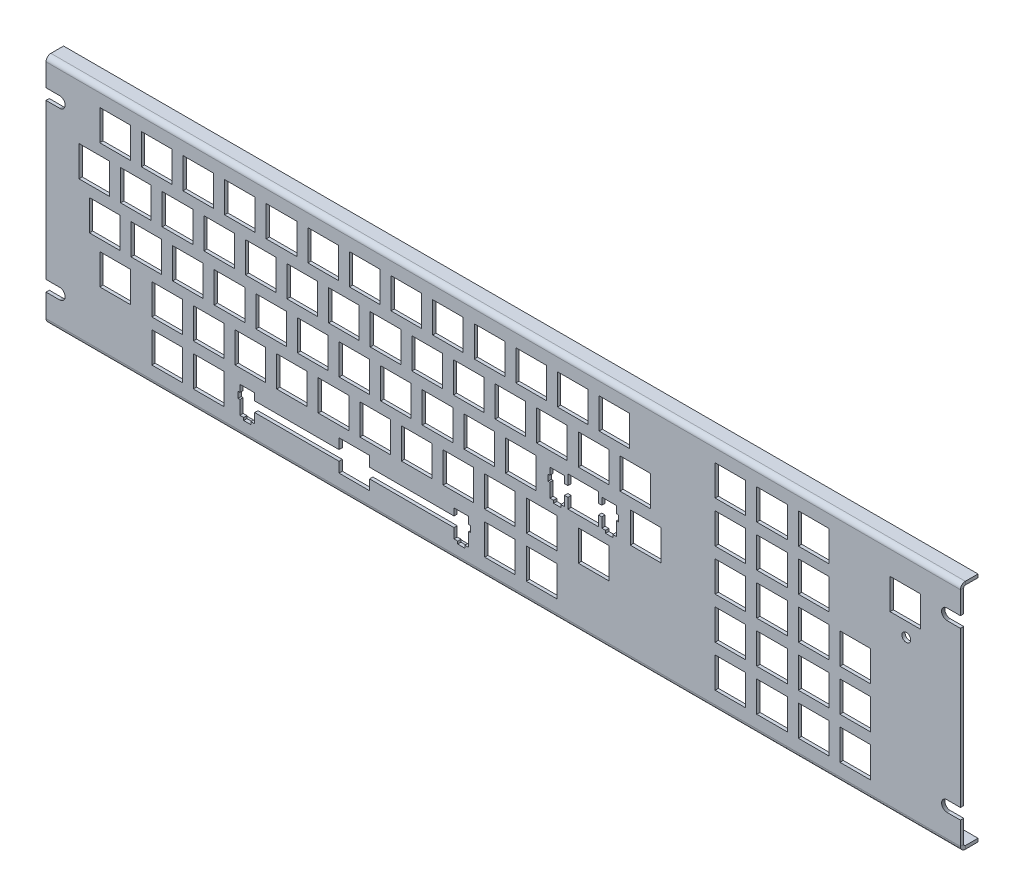
from build123d import *

# Parameters (mm, degrees)
MODEL_R                = 2
MODEL_W                = 14
MODEL_H                = 14
BASE_FLANGE1_DEPTH     = 1.5
SKETCHED_START         = -13.87500635
SKETCHED_BEND1_DEPTH   = 418.67500635
SKETCHED_BEND1_2_DEPTH = 418.67500635
CUT_EXTRUDE1_DEPTH     = 422.76606267
SKETCH12_R             = 2
BOSS_EXTRUDE4_DEPTH    = 1.5


# Read off the part's stored shape, not the designer's step: Sketched Bend1
# Sheet-metal steps are written as plain solids
with BuildPart() as part:
    # Model → Base-Flange1 (new body)
    with BuildSketch(Plane.XY):
        Polygon((404.8, -10), (404.8, -24.5), (398.662814326, -24.5), (398.591424199, -24.501019518), (398.520092298, -24.50407724), (398.448876804, -24.509170673), (398.377835801, -24.516295662), (398.30702723, -24.525446395), (398.236508844, -24.53661541), (398.166338159, -24.549793597), (398.096572407, -24.564970208), (398.02726849, -24.582132863), (397.958482934, -24.601267566), (397.89027184, -24.622358709), (397.822690843, -24.645389091), (397.755795062, -24.670339927), (397.68963906, -24.697190867), (397.624276793, -24.725920012), (397.559761573, -24.756503928), (397.496146018, -24.788917673), (397.433482014, -24.823134807), (397.371820672, -24.859127424), (397.311212282, -24.896866168), (397.251706278, -24.936320258), (397.193351195, -24.977457514), (397.136194627, -25.020244385), (397.080283191, -25.064645973), (397.025662491, -25.110626064), (396.972377075, -25.158147155), (396.920470404, -25.207170488), (396.869984814, -25.257656078), (396.820961481, -25.309562749), (396.77344039, -25.362848165), (396.727460299, -25.417468865), (396.683058711, -25.473380301), (396.64027184, -25.530536869), (396.599134583, -25.588891953), (396.559680494, -25.648397956), (396.52194175, -25.709006346), (396.485949133, -25.770667688), (396.451731998, -25.833331692), (396.419318254, -25.896947247), (396.388734337, -25.961462467), (396.360005193, -26.026824734), (396.333154253, -26.092980737), (396.308203417, -26.159876517), (396.285173035, -26.227457514), (396.264081892, -26.295668608), (396.244947189, -26.364454165), (396.227784533, -26.433758081), (396.212607923, -26.503523833), (396.199429736, -26.573694518), (396.188260721, -26.644212904), (396.179109987, -26.715021475), (396.171984998, -26.786062479), (396.166891566, -26.857277973), (396.163833844, -26.928609873), (396.162814326, -27), (396.163833844, -27.071390127), (396.166891566, -27.142722027), (396.171984998, -27.213937521), (396.179109987, -27.284978525), (396.188260721, -27.355787096), (396.199429736, -27.426305482), (396.212607923, -27.496476167), (396.227784533, -27.566241919), (396.244947189, -27.635545835), (396.264081892, -27.704331392), (396.285173035, -27.772542486), (396.308203417, -27.840123483), (396.333154253, -27.907019263), (396.360005193, -27.973175266), (396.388734337, -28.038537533), (396.419318254, -28.103052753), (396.451731998, -28.166668308), (396.485949133, -28.229332312), (396.52194175, -28.290993654), (396.559680494, -28.351602044), (396.599134583, -28.411108047), (396.64027184, -28.469463131), (396.683058711, -28.526619699), (396.727460299, -28.582531135), (396.77344039, -28.637151835), (396.820961481, -28.690437251), (396.869984814, -28.742343922), (396.920470404, -28.792829512), (396.972377075, -28.841852845), (397.025662491, -28.889373936), (397.080283191, -28.935354027), (397.136194627, -28.979755615), (397.193351195, -29.022542486), (397.251706278, -29.063679742), (397.311212282, -29.103133832), (397.371820672, -29.140872576), (397.433482014, -29.176865193), (397.496146018, -29.211082327), (397.559761573, -29.243496072), (397.624276793, -29.274079988), (397.68963906, -29.302809133), (397.755795062, -29.329660073), (397.822690843, -29.354610909), (397.89027184, -29.377641291), (397.958482934, -29.398732434), (398.02726849, -29.417867137), (398.096572407, -29.435029792), (398.166338159, -29.450206403), (398.236508844, -29.46338459), (398.30702723, -29.474553605), (398.377835801, -29.483704338), (398.448876804, -29.490829327), (398.520092298, -29.49592276), (398.591424199, -29.498980482), (398.662814326, -29.5), (404.8, -29.5), (404.8, -100.55), (398.662814326, -100.55), (398.591424195, -100.551019513), (398.520092291, -100.55407723), (398.448876794, -100.559170658), (398.377835786, -100.566295642), (398.307027211, -100.575446371), (398.236508821, -100.586615382), (398.166338132, -100.599793565), (398.096572376, -100.614970171), (398.027268454, -100.632132823), (397.958482893, -100.651267523), (397.890271795, -100.672358663), (397.822690793, -100.695389042), (397.755795008, -100.720339875), (397.689639001, -100.747190813), (397.62427673, -100.775919955), (397.559761504, -100.80650387), (397.496145945, -100.838917612), (397.433481936, -100.873134745), (397.371820589, -100.909127361), (397.311212195, -100.946866103), (397.251706187, -100.986320192), (397.193351099, -101.027457448), (397.136194526, -101.070244319), (397.080283086, -101.114645906), (397.025662381, -101.160625997), (396.97237696, -101.208147088), (396.920470285, -101.257170422), (396.869984691, -101.307656012), (396.820961354, -101.359562684), (396.773440258, -101.412848101), (396.727460163, -101.467468802), (396.683058571, -101.523380239), (396.640271696, -101.580536808), (396.599134436, -101.638891894), (396.559680343, -101.698397899), (396.521941596, -101.75900629), (396.485948976, -101.820667635), (396.451731838, -101.883331641), (396.419318091, -101.946947198), (396.388734171, -102.011462421), (396.360005024, -102.07682469), (396.333154081, -102.142980695), (396.308203243, -102.209876478), (396.285172859, -102.277457478), (396.264081714, -102.345668575), (396.244947009, -102.414454135), (396.227784352, -102.483758055), (396.21260774, -102.55352381), (396.199429552, -102.623694498), (396.188260536, -102.694212887), (396.179109801, -102.765021462), (396.171984812, -102.836062468), (396.166891379, -102.907277966), (396.163833656, -102.978609869), (396.162814138, -103.05), (396.163833656, -103.12139013), (396.166891379, -103.192722034), (396.171984812, -103.263937531), (396.179109801, -103.334978538), (396.188260536, -103.405787112), (396.199429552, -103.476305501), (396.21260774, -103.54647619), (396.227784352, -103.616241945), (396.244947009, -103.685545865), (396.264081714, -103.754331425), (396.285172859, -103.822542521), (396.308203243, -103.890123521), (396.333154081, -103.957019304), (396.360005024, -104.023175309), (396.388734171, -104.088537579), (396.41931809, -104.153052802), (396.451731838, -104.216668359), (396.485948975, -104.279332365), (396.521941596, -104.340993709), (396.559680343, -104.401602101), (396.599134436, -104.461108106), (396.640271696, -104.519463191), (396.683058571, -104.576619761), (396.727460163, -104.632531198), (396.773440258, -104.687151899), (396.820961353, -104.740437316), (396.86998469, -104.792343987), (396.920470285, -104.842829578), (396.97237696, -104.891852911), (397.02566238, -104.939374003), (397.080283085, -104.985354093), (397.136194525, -105.029755681), (397.193351098, -105.072542552), (397.251706186, -105.113679808), (397.311212195, -105.153133896), (397.371820589, -105.190872639), (397.433481936, -105.226865255), (397.496145944, -105.261082388), (397.559761504, -105.29349613), (397.624276729, -105.324080045), (397.689639001, -105.352809187), (397.755795008, -105.379660125), (397.822690793, -105.404610958), (397.890271794, -105.427641337), (397.958482893, -105.448732477), (398.027268454, -105.467867176), (398.096572375, -105.485029829), (398.166338131, -105.500206435), (398.236508821, -105.513384618), (398.307027211, -105.524553629), (398.377835786, -105.533704358), (398.448876793, -105.540829342), (398.520092291, -105.54592277), (398.591424195, -105.548980487), (398.662814325, -105.55), (404.8, -105.55), (404.8, -117), (404.8, -123.2001524), (-13.87500635, -123.2001524), (-13.87500635, -117), (-13.87500635, -105.5), (-7.629032258, -105.5), (-7.557642128, -105.498980487), (-7.486310224, -105.49592277), (-7.415094726, -105.490829342), (-7.344053719, -105.483704358), (-7.273245144, -105.474553629), (-7.202726754, -105.463384618), (-7.132556064, -105.450206435), (-7.062790308, -105.435029829), (-6.993486387, -105.417867177), (-6.924700826, -105.398732477), (-6.856489727, -105.377641337), (-6.788908726, -105.354610958), (-6.722012941, -105.329660125), (-6.655856934, -105.302809187), (-6.590494662, -105.274080045), (-6.525979437, -105.24349613), (-6.462363877, -105.211082388), (-6.399699869, -105.176865255), (-6.338038522, -105.140872639), (-6.277430127, -105.103133897), (-6.217924119, -105.063679808), (-6.159569031, -105.022542552), (-6.102412458, -104.979755681), (-6.046501018, -104.935354094), (-5.991880313, -104.889374003), (-5.938594893, -104.841852912), (-5.886688218, -104.792829578), (-5.836202623, -104.742343988), (-5.787179286, -104.690437316), (-5.739658191, -104.637151899), (-5.693678096, -104.582531198), (-5.649276504, -104.526619761), (-5.606489629, -104.469463192), (-5.565352369, -104.411108106), (-5.525898275, -104.351602101), (-5.488159529, -104.29099371), (-5.452166908, -104.229332365), (-5.41794977, -104.166668359), (-5.385536023, -104.103052802), (-5.354952104, -104.038537579), (-5.326222956, -103.97317531), (-5.299372014, -103.907019305), (-5.274421175, -103.840123522), (-5.251390792, -103.772542522), (-5.230299646, -103.704331425), (-5.211164942, -103.635545865), (-5.194002284, -103.566241945), (-5.178825673, -103.49647619), (-5.165647485, -103.426305502), (-5.154478468, -103.355787113), (-5.145327734, -103.284978538), (-5.138202744, -103.213937532), (-5.133109311, -103.142722034), (-5.130051589, -103.071390131), (-5.129032071, -103), (-5.130051589, -102.92860987), (-5.133109311, -102.857277966), (-5.138202744, -102.786062469), (-5.145327734, -102.715021462), (-5.154478468, -102.644212888), (-5.165647484, -102.573694499), (-5.178825673, -102.50352381), (-5.194002284, -102.433758055), (-5.211164942, -102.364454135), (-5.230299646, -102.295668575), (-5.251390791, -102.227457479), (-5.274421175, -102.159876479), (-5.299372014, -102.092980696), (-5.326222956, -102.026824691), (-5.354952103, -101.961462421), (-5.385536023, -101.896947198), (-5.41794977, -101.833331641), (-5.452166908, -101.770667635), (-5.488159528, -101.709006291), (-5.525898275, -101.648397899), (-5.565352368, -101.588891894), (-5.606489629, -101.530536809), (-5.649276503, -101.473380239), (-5.693678096, -101.417468802), (-5.73965819, -101.362848101), (-5.787179286, -101.309562684), (-5.836202623, -101.257656013), (-5.886688217, -101.207170422), (-5.938594892, -101.158147089), (-5.991880313, -101.110625997), (-6.046501018, -101.064645907), (-6.102412458, -101.020244319), (-6.159569031, -100.977457448), (-6.217924119, -100.936320192), (-6.277430127, -100.896866104), (-6.338038521, -100.859127361), (-6.399699868, -100.823134745), (-6.462363877, -100.788917612), (-6.525979436, -100.75650387), (-6.590494662, -100.725919955), (-6.655856933, -100.697190813), (-6.72201294, -100.670339875), (-6.788908725, -100.645389042), (-6.856489727, -100.622358663), (-6.924700825, -100.601267523), (-6.993486386, -100.582132824), (-7.062790308, -100.564970171), (-7.132556064, -100.549793565), (-7.202726753, -100.536615382), (-7.273245143, -100.525446371), (-7.344053718, -100.516295642), (-7.415094726, -100.509170658), (-7.486310223, -100.50407723), (-7.557642127, -100.501019513), (-7.629032258, -100.5), (-13.87500635, -100.5), (-13.87500635, -29.5), (-7.629032258, -29.5), (-7.557642131, -29.498980482), (-7.486310231, -29.49592276), (-7.415094737, -29.490829327), (-7.344053733, -29.483704338), (-7.273245162, -29.474553605), (-7.202726776, -29.46338459), (-7.132556091, -29.450206403), (-7.06279034, -29.435029792), (-6.993486423, -29.417867137), (-6.924700866, -29.398732434), (-6.856489772, -29.377641291), (-6.788908775, -29.354610909), (-6.722012995, -29.329660073), (-6.655856992, -29.302809133), (-6.590494726, -29.274079988), (-6.525979505, -29.243496072), (-6.46236395, -29.211082327), (-6.399699946, -29.176865193), (-6.338038604, -29.140872576), (-6.277430214, -29.103133832), (-6.217924211, -29.063679742), (-6.159569127, -29.022542486), (-6.102412559, -28.979755615), (-6.046501124, -28.935354027), (-5.991880423, -28.889373936), (-5.938595007, -28.841852845), (-5.886688336, -28.792829512), (-5.836202746, -28.742343922), (-5.787179413, -28.690437251), (-5.739658322, -28.637151835), (-5.693678231, -28.582531135), (-5.649276643, -28.526619699), (-5.606489772, -28.469463131), (-5.565352516, -28.411108047), (-5.525898426, -28.351602044), (-5.488159682, -28.290993654), (-5.452167065, -28.229332312), (-5.417949931, -28.166668308), (-5.385536186, -28.103052753), (-5.35495227, -28.038537533), (-5.326223125, -27.973175266), (-5.299372185, -27.907019263), (-5.274421349, -27.840123483), (-5.251390967, -27.772542486), (-5.230299824, -27.704331392), (-5.211165121, -27.635545835), (-5.194002466, -27.566241919), (-5.178825855, -27.496476167), (-5.165647668, -27.426305482), (-5.154478653, -27.355787096), (-5.14532792, -27.284978525), (-5.138202931, -27.213937521), (-5.133109498, -27.142722027), (-5.130051776, -27.071390127), (-5.129032258, -27), (-5.130051776, -26.928609873), (-5.133109498, -26.857277973), (-5.138202931, -26.786062479), (-5.14532792, -26.715021475), (-5.154478653, -26.644212904), (-5.165647668, -26.573694518), (-5.178825855, -26.503523833), (-5.194002466, -26.433758081), (-5.211165121, -26.364454165), (-5.230299824, -26.295668608), (-5.251390967, -26.227457514), (-5.274421349, -26.159876517), (-5.299372185, -26.092980737), (-5.326223125, -26.026824734), (-5.35495227, -25.961462467), (-5.385536186, -25.896947247), (-5.417949931, -25.833331692), (-5.452167065, -25.770667688), (-5.488159682, -25.709006346), (-5.525898426, -25.648397956), (-5.565352516, -25.588891953), (-5.606489772, -25.530536869), (-5.649276643, -25.473380301), (-5.693678231, -25.417468865), (-5.739658322, -25.362848165), (-5.787179413, -25.309562749), (-5.836202746, -25.257656078), (-5.886688336, -25.207170488), (-5.938595007, -25.158147155), (-5.991880423, -25.110626064), (-6.046501124, -25.064645973), (-6.102412559, -25.020244385), (-6.159569127, -24.977457514), (-6.217924211, -24.936320258), (-6.277430214, -24.896866168), (-6.338038604, -24.859127424), (-6.399699946, -24.823134807), (-6.46236395, -24.788917673), (-6.525979505, -24.756503928), (-6.590494726, -24.725920012), (-6.655856992, -24.697190867), (-6.722012995, -24.670339927), (-6.788908775, -24.645389091), (-6.856489772, -24.622358709), (-6.924700866, -24.601267566), (-6.993486423, -24.582132863), (-7.06279034, -24.564970208), (-7.132556091, -24.549793597), (-7.202726776, -24.53661541), (-7.273245162, -24.525446395), (-7.344053733, -24.516295662), (-7.415094737, -24.509170673), (-7.486310231, -24.50407724), (-7.557642131, -24.501019518), (-7.629032258, -24.5), (-13.87500635, -24.5), (-13.87500635, -10), (-13.87500635, -7), (404.8, -7), align=None)
        with Locations((5.1501143, -27)):
            Circle(MODEL_R, mode=Mode.SUBTRACT)
        with Locations((5.1501143, -103.0500381)):
            Circle(MODEL_R, mode=Mode.SUBTRACT)
        with Locations((380, -103.1998984)):
            Circle(MODEL_R, mode=Mode.SUBTRACT)
        with Locations((98.712979426, -98)):
            Circle(MODEL_R, mode=Mode.SUBTRACT)
        with Locations((155.863093726, -98)):
            Circle(MODEL_R, mode=Mode.SUBTRACT)
        with Locations((236.822961646, -103.2)):
            Circle(MODEL_R, mode=Mode.SUBTRACT)
        with Locations((285.737998476, -103.1998984)):
            Circle(MODEL_R, mode=Mode.SUBTRACT)
        with Locations((285.737998476, -65.1000762)):
            Circle(MODEL_R, mode=Mode.SUBTRACT)
        with Locations((285.737998476, -26.7500635)):
            Circle(MODEL_R, mode=Mode.SUBTRACT)
        with Locations((380, -18.500127)):
            Circle(MODEL_R, mode=Mode.SUBTRACT)
        with Locations((380, -45.500127)):
            Circle(MODEL_R, mode=Mode.SUBTRACT)
        with Locations((55.85, -27)):
            Rectangle(MODEL_W, MODEL_H, mode=Mode.SUBTRACT)
        with Locations((17.75, -27)):
            Rectangle(MODEL_W, MODEL_H, mode=Mode.SUBTRACT)
        with Locations((36.8, -27)):
            Rectangle(MODEL_W, MODEL_H, mode=Mode.SUBTRACT)
        with Locations((74.9000508, -27)):
            Rectangle(MODEL_W, MODEL_H, mode=Mode.SUBTRACT)
        with Locations((93.9500889, -27)):
            Rectangle(MODEL_W, MODEL_H, mode=Mode.SUBTRACT)
        with Locations((113.000127, -27)):
            Rectangle(MODEL_W, MODEL_H, mode=Mode.SUBTRACT)
        with Locations((132.0499111, -27)):
            Rectangle(MODEL_W, MODEL_H, mode=Mode.SUBTRACT)
        with Locations((151.0999492, -27)):
            Rectangle(MODEL_W, MODEL_H, mode=Mode.SUBTRACT)
        with Locations((170.1499873, -27)):
            Rectangle(MODEL_W, MODEL_H, mode=Mode.SUBTRACT)
        with Locations((189.2000254, -27)):
            Rectangle(MODEL_W, MODEL_H, mode=Mode.SUBTRACT)
        with Locations((208.2500635, -27)):
            Rectangle(MODEL_W, MODEL_H, mode=Mode.SUBTRACT)
        with Locations((227.3001016, -27)):
            Rectangle(MODEL_W, MODEL_H, mode=Mode.SUBTRACT)
        with Locations((246.3501397, -27)):
            Rectangle(MODEL_W, MODEL_H, mode=Mode.SUBTRACT)
        with Locations((299.488061976, -27)):
            Rectangle(MODEL_W, MODEL_H, mode=Mode.SUBTRACT)
        with Locations((299.488061976, -46.0497841)):
            Rectangle(MODEL_W, MODEL_H, mode=Mode.SUBTRACT)
        with Locations((255.87490475, -46.0497841)):
            Rectangle(MODEL_W, MODEL_H, mode=Mode.SUBTRACT)
        with Locations((236.82512065, -46.0497841)):
            Rectangle(MODEL_W, MODEL_H, mode=Mode.SUBTRACT)
        with Locations((217.77508255, -46.0497841)):
            Rectangle(MODEL_W, MODEL_H, mode=Mode.SUBTRACT)
        with Locations((198.72504445, -46.0497841)):
            Rectangle(MODEL_W, MODEL_H, mode=Mode.SUBTRACT)
        with Locations((318.538100076, -27)):
            Rectangle(MODEL_W, MODEL_H, mode=Mode.SUBTRACT)
        with Locations((337.588138176, -27)):
            Rectangle(MODEL_W, MODEL_H, mode=Mode.SUBTRACT)
        with Locations((318.538100076, -46.0497841)):
            Rectangle(MODEL_W, MODEL_H, mode=Mode.SUBTRACT)
        with Locations((337.588138176, -46.0497841)):
            Rectangle(MODEL_W, MODEL_H, mode=Mode.SUBTRACT)
        with Locations((299.488315977, -65.1000762)):
            Rectangle(MODEL_W, MODEL_H, mode=Mode.SUBTRACT)
        with Locations((318.538100076, -65.1000762)):
            Rectangle(MODEL_W, MODEL_H, mode=Mode.SUBTRACT)
        with Locations((337.588138176, -65.1000762)):
            Rectangle(MODEL_W, MODEL_H, mode=Mode.SUBTRACT)
        with Locations((299.488061976, -84.1498603)):
            Rectangle(MODEL_W, MODEL_H, mode=Mode.SUBTRACT)
        with Locations((318.538100076, -84.1498603)):
            Rectangle(MODEL_W, MODEL_H, mode=Mode.SUBTRACT)
        with Locations((337.588138176, -84.1498603)):
            Rectangle(MODEL_W, MODEL_H, mode=Mode.SUBTRACT)
        with Locations((337.588900178, -103.199136398)):
            Rectangle(MODEL_W, MODEL_H, mode=Mode.SUBTRACT)
        with Locations((318.538100076, -103.1998984)):
            Rectangle(MODEL_W, MODEL_H, mode=Mode.SUBTRACT)
        with Locations((299.488061976, -103.1998984)):
            Rectangle(MODEL_W, MODEL_H, mode=Mode.SUBTRACT)
        with Locations((260.638430277, -65.099568199)):
            Rectangle(MODEL_W, MODEL_H, mode=Mode.SUBTRACT)
        with Locations((236.82512065, -84.1498603)):
            Rectangle(MODEL_W, MODEL_H, mode=Mode.SUBTRACT)
        with Locations((379.598806198, -31.999237998)):
            Rectangle(MODEL_W, MODEL_H, mode=Mode.SUBTRACT)
        with Locations((213.013081026, -84.1498603)):
            Rectangle(MODEL_W, MODEL_H, mode=Mode.SUBTRACT)
        with Locations((203.488061976, -65.1000762)):
            Rectangle(MODEL_W, MODEL_H, mode=Mode.SUBTRACT)
        with Locations((213.013081026, -103.1998984)):
            Rectangle(MODEL_W, MODEL_H, mode=Mode.SUBTRACT)
        with Locations((193.963296927, -103.2001524)):
            Rectangle(MODEL_W, MODEL_H, mode=Mode.SUBTRACT)
        with Locations((193.963042926, -84.1498603)):
            Rectangle(MODEL_W, MODEL_H, mode=Mode.SUBTRACT)
        with Locations((174.913004826, -84.1498603)):
            Rectangle(MODEL_W, MODEL_H, mode=Mode.SUBTRACT)
        with Locations((184.438023876, -65.0998222)):
            Rectangle(MODEL_W, MODEL_H, mode=Mode.SUBTRACT)
        with Locations((179.67500635, -46.0497841)):
            Rectangle(MODEL_W, MODEL_H, mode=Mode.SUBTRACT)
        with Locations((160.62496825, -46.0497841)):
            Rectangle(MODEL_W, MODEL_H, mode=Mode.SUBTRACT)
        with Locations((165.387985776, -65.0998222)):
            Rectangle(MODEL_W, MODEL_H, mode=Mode.SUBTRACT)
        with Locations((141.57493015, -46.0497841)):
            Rectangle(MODEL_W, MODEL_H, mode=Mode.SUBTRACT)
        with Locations((146.337947676, -65.0998222)):
            Rectangle(MODEL_W, MODEL_H, mode=Mode.SUBTRACT)
        with Locations((155.862966726, -84.1498603)):
            Rectangle(MODEL_W, MODEL_H, mode=Mode.SUBTRACT)
        with Locations((8.22491745, -46.0497841)):
            Rectangle(MODEL_W, MODEL_H, mode=Mode.SUBTRACT)
        with Locations((27.27495555, -46.0497841)):
            Rectangle(MODEL_W, MODEL_H, mode=Mode.SUBTRACT)
        with Locations((46.32499365, -46.0497841)):
            Rectangle(MODEL_W, MODEL_H, mode=Mode.SUBTRACT)
        with Locations((65.37503175, -46.0497841)):
            Rectangle(MODEL_W, MODEL_H, mode=Mode.SUBTRACT)
        with Locations((84.42506985, -46.0497841)):
            Rectangle(MODEL_W, MODEL_H, mode=Mode.SUBTRACT)
        with Locations((103.47510795, -46.0497841)):
            Rectangle(MODEL_W, MODEL_H, mode=Mode.SUBTRACT)
        with Locations((122.52489205, -46.0497841)):
            Rectangle(MODEL_W, MODEL_H, mode=Mode.SUBTRACT)
        with Locations((127.287909576, -65.0998222)):
            Rectangle(MODEL_W, MODEL_H, mode=Mode.SUBTRACT)
        with Locations((136.812928626, -84.1498603)):
            Rectangle(MODEL_W, MODEL_H, mode=Mode.SUBTRACT)
        with Locations((108.238125476, -65.0998222)):
            Rectangle(MODEL_W, MODEL_H, mode=Mode.SUBTRACT)
        with Locations((89.188087376, -65.0998222)):
            Rectangle(MODEL_W, MODEL_H, mode=Mode.SUBTRACT)
        with Locations((70.138049276, -65.1000762)):
            Rectangle(MODEL_W, MODEL_H, mode=Mode.SUBTRACT)
        with Locations((51.088011176, -65.1000762)):
            Rectangle(MODEL_W, MODEL_H, mode=Mode.SUBTRACT)
        with Locations((32.037973076, -65.1000762)):
            Rectangle(MODEL_W, MODEL_H, mode=Mode.SUBTRACT)
        with Locations((12.987934976, -65.0998222)):
            Rectangle(MODEL_W, MODEL_H, mode=Mode.SUBTRACT)
        with Locations((17.7499365, -84.1498603)):
            Rectangle(MODEL_W, MODEL_H, mode=Mode.SUBTRACT)
        with Locations((41.562992126, -84.1498603)):
            Rectangle(MODEL_W, MODEL_H, mode=Mode.SUBTRACT)
        with Locations((60.613030226, -84.1498603)):
            Rectangle(MODEL_W, MODEL_H, mode=Mode.SUBTRACT)
        with Locations((79.663068326, -84.1498603)):
            Rectangle(MODEL_W, MODEL_H, mode=Mode.SUBTRACT)
        with Locations((98.713106426, -84.1498603)):
            Rectangle(MODEL_W, MODEL_H, mode=Mode.SUBTRACT)
        with Locations((117.763144526, -84.1498603)):
            Rectangle(MODEL_W, MODEL_H, mode=Mode.SUBTRACT)
        with Locations((60.613284227, -103.2001524)):
            Rectangle(MODEL_W, MODEL_H, mode=Mode.SUBTRACT)
        with Locations((41.563246126, -103.1998984)):
            Rectangle(MODEL_W, MODEL_H, mode=Mode.SUBTRACT)
        with Locations((356.638176276, -65.0998222)):
            Rectangle(MODEL_W, MODEL_H, mode=Mode.SUBTRACT)
        with Locations((356.638176276, -84.1498603)):
            Rectangle(MODEL_W, MODEL_H, mode=Mode.SUBTRACT)
        with Locations((356.637922276, -103.199644399)):
            Rectangle(MODEL_W, MODEL_H, mode=Mode.SUBTRACT)
        with Locations((232.063373127, -65.099568199)):
            Rectangle(MODEL_W, MODEL_H, mode=Mode.SUBTRACT)
        with Locations((127.287909576, -103.1998984)):
            Rectangle(MODEL_W, MODEL_H, mode=Mode.SUBTRACT)
    extrude(amount=-BASE_FLANGE1_DEPTH)

    # Sketched Bend1 outline → Sketched Bend1 (cut)
    with BuildSketch(Plane.YZ.offset(SKETCHED_START)):
        with BuildLine():
            Line((-123.2001524, -1.5), (-118.115642246, -1.5))
            ThreePointArc((-118.115642246, -1.5), (-117.298982472, -0.413161062), (-116.00381839, 0))
            Line((-116.00381839, 0), (-123.2001524, 0))
            Line((-123.2001524, 0), (-123.2001524, -1.5))
        make_face()
        with BuildLine():
            ThreePointArc((-14.19633401, 0), (-12.901169928, -0.413161062), (-12.084510154, -1.5))
            Line((-12.084510154, -1.5), (-7, -1.5))
            Line((-7, -1.5), (-7, 0))
            Line((-7, 0), (-14.19633401, 0))
        make_face()
    extrude(amount=SKETCHED_BEND1_DEPTH, mode=Mode.SUBTRACT)

    # Sketched Bend1 2 outline → Sketched Bend1 2 (add)
    with BuildSketch(Plane.YZ.offset(SKETCHED_START)):
        with BuildLine():
            Line((-116.74041839, -8.040265986), (-116.74041839, -2.2366))
            ThreePointArc((-116.74041839, -2.2366), (-116.524673245, -1.715745145), (-116.00381839, -1.5))
            Line((-116.00381839, -1.5), (-118.115642246, -1.5))
            ThreePointArc((-118.115642246, -1.5), (-118.209003733, -1.863053267), (-118.24041839, -2.2366))
            Line((-118.24041839, -2.2366), (-118.24041839, -8.040265986))
            Line((-118.24041839, -8.040265986), (-116.74041839, -8.040265986))
        make_face()
        with BuildLine():
            Line((-12.084510154, -1.5), (-14.19633401, -1.5))
            ThreePointArc((-14.19633401, -1.5), (-13.675479155, -1.715745145), (-13.45973401, -2.2366))
            Line((-13.45973401, -2.2366), (-13.45973401, -8.040265987))
            Line((-13.45973401, -8.040265987), (-11.95973401, -8.040265987))
            Line((-11.95973401, -8.040265987), (-11.95973401, -2.2366))
            ThreePointArc((-11.95973401, -2.2366), (-11.991148667, -1.863053267), (-12.084510154, -1.5))
        make_face()
    extrude(amount=SKETCHED_BEND1_2_DEPTH)

    # Sketch13 → Cut-Extrude1 (cut, through all)
    with BuildSketch(Plane(origin=(0, 0, -1.5), x_dir=(-1, 0, 0), z_dir=(0, 0, -1))):
        Polygon((-120.287909576, -105.4998984), (-81.661798324, -105.4998984), (-81.661798324, -109.9698984), (-79.936798324, -109.9698984), (-79.936798324, -111.1698984), (-76.636798324, -111.1698984), (-76.636798324, -109.9698984), (-74.911798324, -109.9698984), (-74.911798324, -103.6998984), (-74.091798324, -103.6998984), (-74.091798324, -100.8998984), (-74.911798324, -100.8998984), (-74.911798324, -97.6698984), (-81.661798324, -97.6698984), (-81.661798324, -100.8998984), (-120.287909576, -100.8998984), align=None)
        Polygon((-134.287909576, -100.8998984), (-172.914020828, -100.8998984), (-172.914020828, -97.6698984), (-179.664020828, -97.6698984), (-179.664020828, -100.8998984), (-180.484020828, -100.8998984), (-180.484020828, -103.6998984), (-179.664020828, -103.6998984), (-179.664020828, -109.9698984), (-177.939020828, -109.9698984), (-177.939020828, -111.1698984), (-174.639020828, -111.1698984), (-174.639020828, -109.9698984), (-172.914020828, -109.9698984), (-172.914020828, -105.4998984), (-134.287909576, -105.4998984), align=None)
        Polygon((-225.063373127, -67.399568199), (-223.538373127, -67.399568199), (-223.538373127, -71.869568199), (-221.813373127, -71.869568199), (-221.813373127, -73.069568199), (-218.513373127, -73.069568199), (-218.513373127, -71.869568199), (-216.788373127, -71.869568199), (-216.788373127, -65.599568199), (-215.968373127, -65.599568199), (-215.968373127, -62.799568199), (-216.788373127, -62.799568199), (-216.788373127, -59.569568199), (-223.538373127, -59.569568199), (-223.538373127, -62.799568199), (-225.063373127, -62.799568199), align=None)
        Polygon((-239.063373127, -67.399568199), (-240.588373127, -67.399568199), (-240.588373127, -71.869568199), (-242.313373127, -71.869568199), (-242.313373127, -73.069568199), (-245.613373127, -73.069568199), (-245.613373127, -71.869568199), (-247.338373127, -71.869568199), (-247.338373127, -65.599568199), (-248.158373127, -65.599568199), (-248.158373127, -62.799568199), (-247.338373127, -62.799568199), (-247.338373127, -59.569568199), (-240.588373127, -59.569568199), (-240.588373127, -62.799568199), (-239.063373127, -62.799568199), align=None)
    extrude(amount=-CUT_EXTRUDE1_DEPTH, mode=Mode.SUBTRACT)

    # Sketch12 → Boss-Extrude4 (add)
    with BuildSketch(Plane.XY):
        with Locations((5.1501143, -27)):
            Circle(SKETCH12_R)
        with Locations((5.1501143, -103.0500381)):
            Circle(SKETCH12_R)
        with Locations((98.712979426, -98)):
            Circle(SKETCH12_R)
        with Locations((155.863093726, -98)):
            Circle(SKETCH12_R)
        with Locations((236.822961646, -103.2)):
            Circle(SKETCH12_R)
        with Locations((285.737998476, -26.7500635)):
            Circle(SKETCH12_R)
        with Locations((285.737998476, -103.1998984)):
            Circle(SKETCH12_R)
        with Locations((285.737998476, -65.1000762)):
            Circle(SKETCH12_R)
        with Locations((380, -18.500127)):
            Circle(SKETCH12_R)
        with Locations((380, -103.1998984)):
            Circle(SKETCH12_R)
    extrude(amount=-BOSS_EXTRUDE4_DEPTH)


solid = part.part
